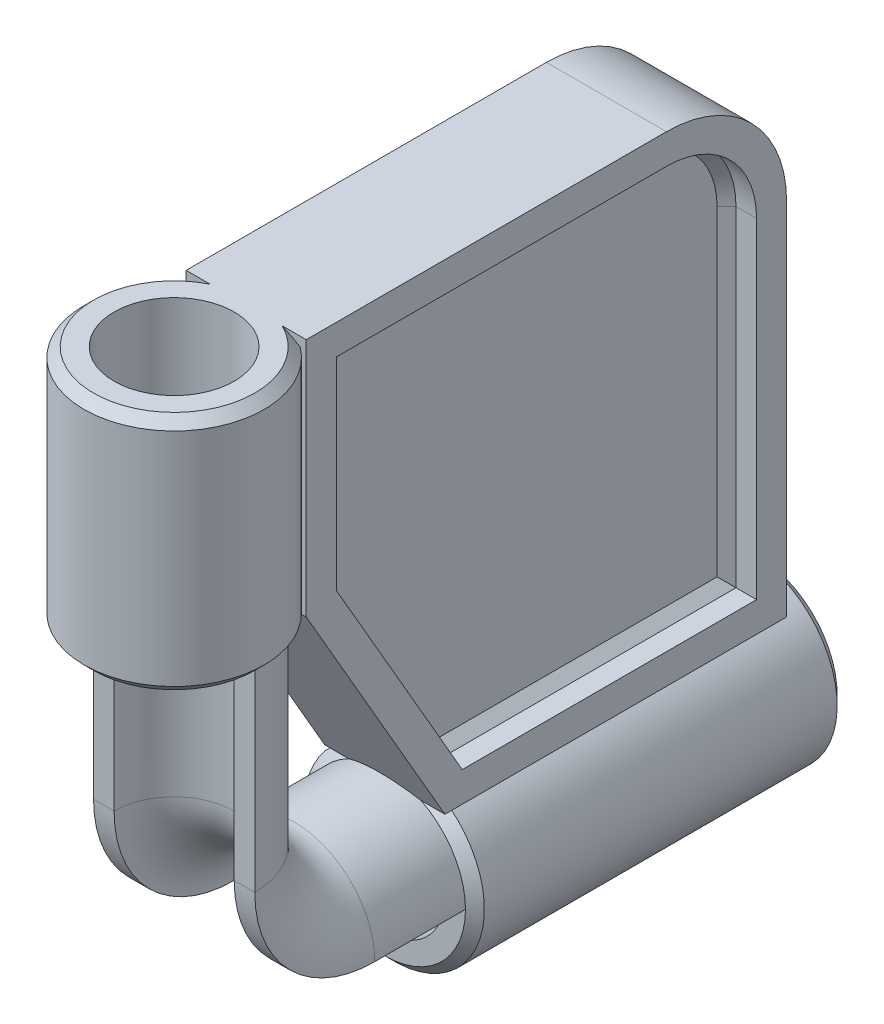
from build123d import *

# Parameters (mm, degrees)
BOSS_EXTRUDE1_DEPTH      = 6.35
FILLET1_R                = 12.7
CUT_EXTRUDE2_DEPTH       = 3.175
BOSS_EXTRUDE2_DEPTH      = 3.175
BOSS_EXTRUDE2_DEPTH_BACK = 36.135303
SKETCH4_R                = 9.525
SKETCH4_R_2              = 6.35
SKETCH5_R                = 9.525
SKETCH5_R_2              = 6.35
BOSS_EXTRUDE3_DEPTH      = 25.4
CHAMFER2_SIZE            = 1
CHAMFER4_SIZE            = 1


with BuildPart() as part:
    # Sketch1 → Boss-Extrude1 (new, symmetric)
    with BuildSketch(Plane.YZ):
        Polygon((-25.4, 10.735303163), (0, 25.4), (25.4, 25.4), (25.4, -25.4), (-25.4, -25.4), align=None)
    extrude(amount=BOSS_EXTRUDE1_DEPTH, both=True)

    # Fillet1
    fillet1_edges = [part.edges().sort_by_distance(p)[0] for p in [
        (0, 25.4, -25.4),
    ]]
    fillet(fillet1_edges, radius=FILLET1_R)

    # Sketch3 → Cut-Extrude2 (cut)
    with BuildSketch(Plane.YZ.offset(6.35)):
        with BuildLine():
            Line((-22.225, -22.225), (12.7, -22.225))
            ThreePointArc((12.7, -22.225), (19.435192091, -19.435192091), (22.225, -12.7))
            Line((22.225, -12.7), (22.225, 22.225))
            Line((22.225, 22.225), (0.850738686, 22.225))
            Line((0.850738686, 22.225), (-22.225, 8.902216058))
            Line((-22.225, 8.902216058), (-22.225, -22.225))
        make_face()
    extrude(amount=-CUT_EXTRUDE2_DEPTH, mode=Mode.SUBTRACT)

    # Sketch4 → Boss-Extrude2 (add, two sides: drawn at the far end of the back side and taken through both)
    with BuildSketch(Plane(origin=(0, 0, -25.4), x_dir=(1, 0, 0), z_dir=(0, 0, -1)).offset(-BOSS_EXTRUDE2_DEPTH_BACK)):
        with Locations(Location((0, 33.02, 0), (0, 0, 233.130102354))):
            Circle(SKETCH4_R)
        with Locations(Location((0, 33.02, 0), (0, 0, 270))):
            Circle(SKETCH4_R_2, mode=Mode.SUBTRACT)
    extrude(amount=BOSS_EXTRUDE2_DEPTH + BOSS_EXTRUDE2_DEPTH_BACK)

    # Sketch5 → Boss-Extrude3 (add)
    with BuildSketch(Plane(origin=(0, 25.4, 0), x_dir=(-1, 0, 0), z_dir=(0, 1, 0))):
        with Locations((0, 33.02)):
            Circle(SKETCH5_R)
        with Locations(Location((0, 33.02, 0), (0, 0, 90))):
            Circle(SKETCH5_R_2, mode=Mode.SUBTRACT)
    extrude(amount=-BOSS_EXTRUDE3_DEPTH)

    # Chamfer2
    # the kernel refuses this chamfer: 1 mm, written as the material it takes off along each edge
    with BuildSketch(Plane(origin=(0, -33.02, 10.735303), x_dir=(0.3638595085405839, 0.931453841070294, 0), z_dir=(-0.931453841070294, 0.3638595085405839, 0))) as chamfer2_piece_1_section:
        Polygon((9.525, CHAMFER2_SIZE), (9.525 - CHAMFER2_SIZE, 0), (9.525, 0), align=None)
    chamfer2_piece_1 = revolve(axis=Axis((0, -33.02, 10.735303), (0, 0, -1)), revolution_arc=317.325176487, mode=Mode.PRIVATE)
    chamfer2_piece_1 = split(chamfer2_piece_1, bisect_by=Plane(origin=(5.777045626, -25.4, 10.24862198), z_dir=(0, -1, 0)), keep=Keep.TOP, mode=Mode.PRIVATE)
    add(chamfer2_piece_1, mode=Mode.SUBTRACT)
    with BuildSketch(Plane(origin=(0, -33.02, -28.575), x_dir=(-0.6000000000021781, 0.7999999999983665, 0), z_dir=(-0.7999999999983665, -0.6000000000021781, 0))) as chamfer2_piece_2:
        Polygon((9.525, -CHAMFER2_SIZE), (9.525 - CHAMFER2_SIZE, 0), (9.525, 0), align=None)
    revolve(axis=Axis((0, -33.02, -28.575), (0, 0, -1)), mode=Mode.SUBTRACT)
    with BuildSketch(Plane(origin=(0, 25.4, 33.02), x_dir=(-0.3638595085405501, 0, -0.9314538410703074), z_dir=(0.9314538410703074, 0, -0.3638595085405501))) as chamfer2_piece_3_section:
        Polygon((9.525, -CHAMFER2_SIZE), (9.525 - CHAMFER2_SIZE, 0), (9.525, 0), align=None)
    chamfer2_piece_3 = revolve(axis=Axis((0, 25.4, 33.02), (0, 1, 0)), revolution_arc=317.325176487, mode=Mode.PRIVATE)
    chamfer2_piece_3 = split(chamfer2_piece_3, bisect_by=Plane(origin=(0, 24.920234358, 25.4), z_dir=(0, 0, 1)), keep=Keep.TOP, mode=Mode.PRIVATE)
    add(chamfer2_piece_3, mode=Mode.SUBTRACT)
    with BuildSketch(Plane(origin=(0, 0, 33.02), x_dir=(-0.3638595085405531, 0, -0.9314538410703063), z_dir=(0.9314538410703063, 0, -0.3638595085405531))) as chamfer2_piece_4_section:
        Polygon((9.525, CHAMFER2_SIZE), (9.525 - CHAMFER2_SIZE, 0), (9.525, 0), align=None)
    chamfer2_piece_4 = revolve(axis=Axis((0, 0, 33.02), (0, 1, 0)), revolution_arc=317.325176487, mode=Mode.PRIVATE)
    chamfer2_piece_4 = split(chamfer2_piece_4, bisect_by=Plane(origin=(-5.452412952, 0.490850729, 25.4), z_dir=(0, 0, 1)), keep=Keep.TOP, mode=Mode.PRIVATE)
    add(chamfer2_piece_4, mode=Mode.SUBTRACT)

    # Sweep3: sweep along a path in Sketch6
    with BuildLine(Plane.YZ) as sweep3_path:
        Line((0, 33.02), (-20.32, 33.02))
        ThreePointArc((-20.32, 33.02), (-29.300256121, 29.300256121), (-33.02, 20.32))
        Line((-33.02, 20.32), (-33.02, 10.735303163))
    # Sketch7 → Sweep3 (sweep)
    with BuildSketch(Plane.XZ):
        with BuildLine():
            Line((-8.525, 33.02), (-6.35, 33.02))
            ThreePointArc((-6.35, 33.02), (0, 26.67), (6.35, 33.02))
            Line((6.35, 33.02), (8.525, 33.02))
            ThreePointArc((8.525, 33.02), (0, 24.495), (-8.525, 33.02))
        make_face()
    sweep(path=sweep3_path.line)

    # Chamfer4
    chamfer4_edges = [part.edges().sort_by_distance(p)[0] for p in [
        (3.175, -22.225, -6.661391971),
        (3.175, -10.687130657, 15.563608029),
        (3.175, 11.537869343, 22.225),
        (3.175, 22.225, 4.7625),
        (3.175, 19.435192091, -19.435192091),
        (3.175, -4.7625, -22.225),
    ]]
    chamfer(chamfer4_edges, length=CHAMFER4_SIZE)


solid = part.part
